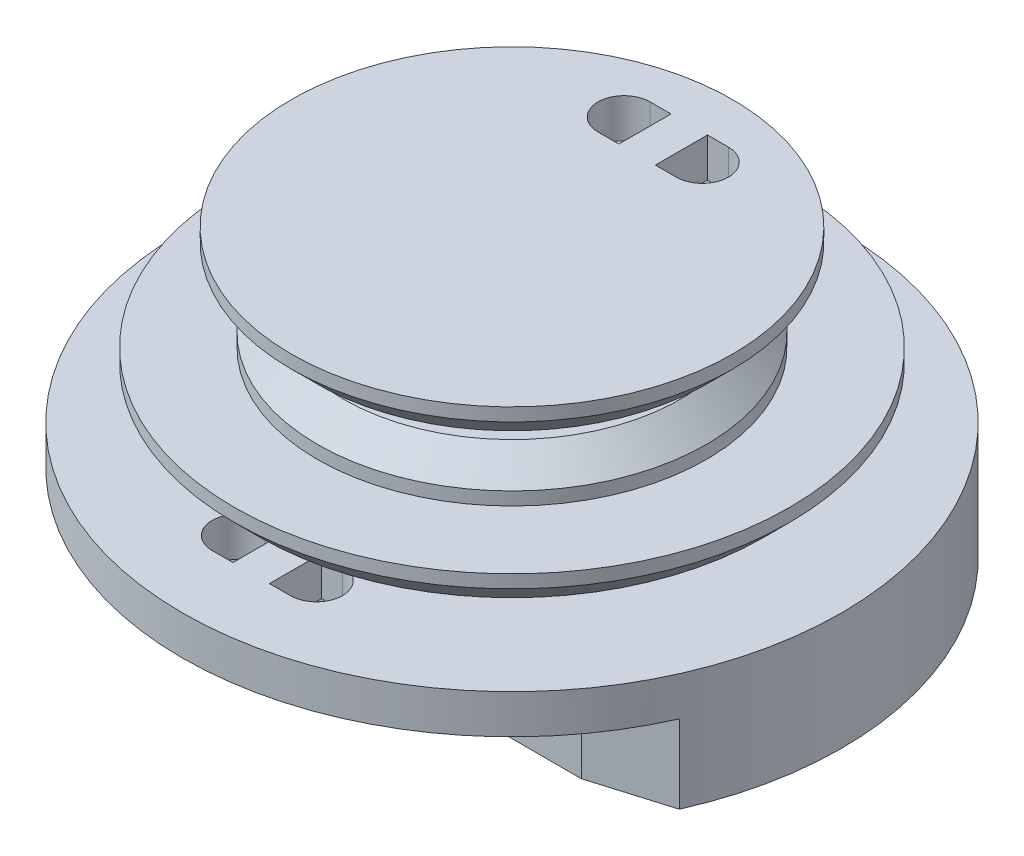
from build123d import *

# Parameters (mm, degrees)
SKETCH_24_R         = 7.643312102
BOSS_EXTRUDE1_DEPTH = 4
SKETCH3_W           = 5
SKETCH3_H           = 1.5
SKETCH3_W_2         = 3
SKETCH5_R           = 4.458598726
BOSS_EXTRUDE2_DEPTH = 4
SKETCH6_W           = 4
SKETCH6_H           = 1.5
SKETCH6_W_2         = 3
CUT_EXTRUDE2_DEPTH  = 2
CUT_EXTRUDE3_DEPTH  = 2
BOSS_EXTRUDE4_START = 3
SKETCH10_R          = 0.5
BOSS_EXTRUDE4_DEPTH = 3
CHAMFER1_START      = -4
CHAMFER1_2_DEPTH    = 4


with BuildPart() as part:
    # Sketch 24 → Boss-Extrude1 (new body)
    with BuildSketch(Plane(origin=(0, 0, 0), x_dir=(1, 0, 0), z_dir=(0, 1, 0))):
        with Locations(Location((0, 0, 0), (0, 0, 270))):
            Circle(SKETCH_24_R)
    extrude(amount=BOSS_EXTRUDE1_DEPTH)

    # Sketch3 → Revolve1 (revolve)
    with BuildSketch(Plane.XY, mode=Mode.PRIVATE) as revolve1_sk:
        with Locations((-10.143312102, 0.75)):
            Rectangle(SKETCH3_W, SKETCH3_H)
        with Locations((-9.143312102, 3.25)):
            Rectangle(SKETCH3_W_2, SKETCH3_H)
    revolve(revolve1_sk.sketch.rotate(Axis((0, 4, 0), (0, -1, 0)), 270), axis=Axis((0, 4, 0), (0, -1, 0)))

    # Sketch5 → Boss-Extrude2 (add)
    with BuildSketch(Plane(origin=(0, 4, 0), x_dir=(1, 0, 0), z_dir=(0, 1, 0))):
        with Locations(Location((0, 0, 0), (0, 0, 270))):
            Circle(SKETCH5_R)
    extrude(amount=BOSS_EXTRUDE2_DEPTH)

    # Sketch6 → Revolve2 (revolve)
    with BuildSketch(Plane.XY, mode=Mode.PRIVATE) as revolve2_sk:
        with Locations((-6.458598726, 7.25)):
            Rectangle(SKETCH6_W, SKETCH6_H)
        with Locations((-5.958598726, 4.75)):
            Rectangle(SKETCH6_W_2, SKETCH6_H)
    revolve(revolve2_sk.sketch.rotate(Axis((0, 4, 0), (0, -1, 0)), 270), axis=Axis((0, 4, 0), (0, -1, 0)))

    # Sketch8 → Cut-Extrude2 (cut)
    with BuildSketch(Plane.XZ):
        with BuildLine():
            Line((-0.7, 10), (-1.5, 10))
            ThreePointArc((-1.5, 10), (-2.5, 9), (-1.5, 8))
            Line((-1.5, 8), (-0.7, 8))
            Line((-0.7, 8), (-0.7, 10))
        make_face()
        with BuildLine():
            Line((1.5, 10), (0.7, 10))
            Line((0.7, 10), (0.7, 8))
            Line((0.7, 8), (1.5, 8))
            ThreePointArc((1.5, 8), (2.5, 9), (1.5, 10))
        make_face()
    extrude(amount=-CUT_EXTRUDE2_DEPTH, mode=Mode.SUBTRACT)

    # Sketch9 → Cut-Extrude3 (cut)
    with BuildSketch(Plane(origin=(0, 8, -8), x_dir=(-1, 0, 0), z_dir=(0, -1, 0))):
        with BuildLine():
            Line((-0.7, -1.2), (-1.5, -1.2))
            ThreePointArc((-1.5, -1.2), (-2.5, -2.2), (-1.5, -3.2))
            Line((-1.5, -3.2), (-0.7, -3.2))
            Line((-0.7, -3.2), (-0.7, -1.2))
        make_face()
        with BuildLine():
            Line((1.5, -1.2), (0.7, -1.2))
            Line((0.7, -1.2), (0.7, -3.2))
            Line((0.7, -3.2), (1.5, -3.2))
            ThreePointArc((1.5, -3.2), (2.5, -2.2), (1.5, -1.2))
        make_face()
    extrude(amount=CUT_EXTRUDE3_DEPTH, mode=Mode.SUBTRACT)

    # Sketch10 → Boss-Extrude4 (add)
    with BuildSketch(Plane.XZ.offset(BOSS_EXTRUDE4_START)):
        with BuildLine():
            Line((11.12894159, 6), (-11.12894159, 6))
            ThreePointArc((-11.12894159, 6), (-6.572693348, -10.800603829), (10.442822057, -7.127468582))
            ThreePointArc((10.442822057, -7.127468582), (12.080670499, -3.729710606), (12.643312102, 0))
            ThreePointArc((12.643312102, 0), (12.258874801, 3.094079752), (11.12894159, 6))
        make_face()
        with Locations(Location((-7.25, 0, 0), (0, 0, 270))):
            Circle(SKETCH10_R, mode=Mode.SUBTRACT)
        with Locations(Location((7.25, 0, 0), (0, 0, 270))):
            Circle(SKETCH10_R, mode=Mode.SUBTRACT)
    extrude(amount=-BOSS_EXTRUDE4_DEPTH)

    # Chamfer1: read off the stored shape, not the designer's step
    # Chamfer1 outline → Chamfer1 (revolve, cut)
    with BuildSketch(Plane.XY):
        Polygon((10.643312102, 3.5), (9.643312102, 2.5), (10.643312102, 2.5), align=None)
        Polygon((6.458598726, 5.5), (7.458598726, 4.5), (7.458598726, 5.5), align=None)
        Polygon((7.458598726, 6.5), (8.458598726, 6.5), (8.458598726, 7.5), align=None)
    revolve(axis=Axis((0, 0, 0), (0, 1, 0)), mode=Mode.SUBTRACT)

    # Chamfer1 2 outline → Chamfer1 2 (cut)
    with BuildSketch(Plane(origin=(0, 0, 0), x_dir=(1, 0, 0), z_dir=(0, 1, 0)).offset(CHAMFER1_START)):
        with BuildLine():
            ThreePointArc((11.12894159, -6), (11.349578809, -5.571391366), (11.553716625, -5.134683345))
            Line((11.553716625, -5.134683345), (8.663849742, -6))
            Line((8.663849742, -6), (11.12894159, -6))
        make_face()
        with BuildLine():
            Line((-11.12894159, -6), (-10.12894159, -6))
            Line((-10.12894159, -6), (-11.923354215, -4.205587374))
            ThreePointArc((-11.923354215, -4.205587374), (-11.561014862, -5.118229798), (-11.12894159, -6))
        make_face()
    extrude(amount=CHAMFER1_2_DEPTH, mode=Mode.SUBTRACT)


solid = part.part
